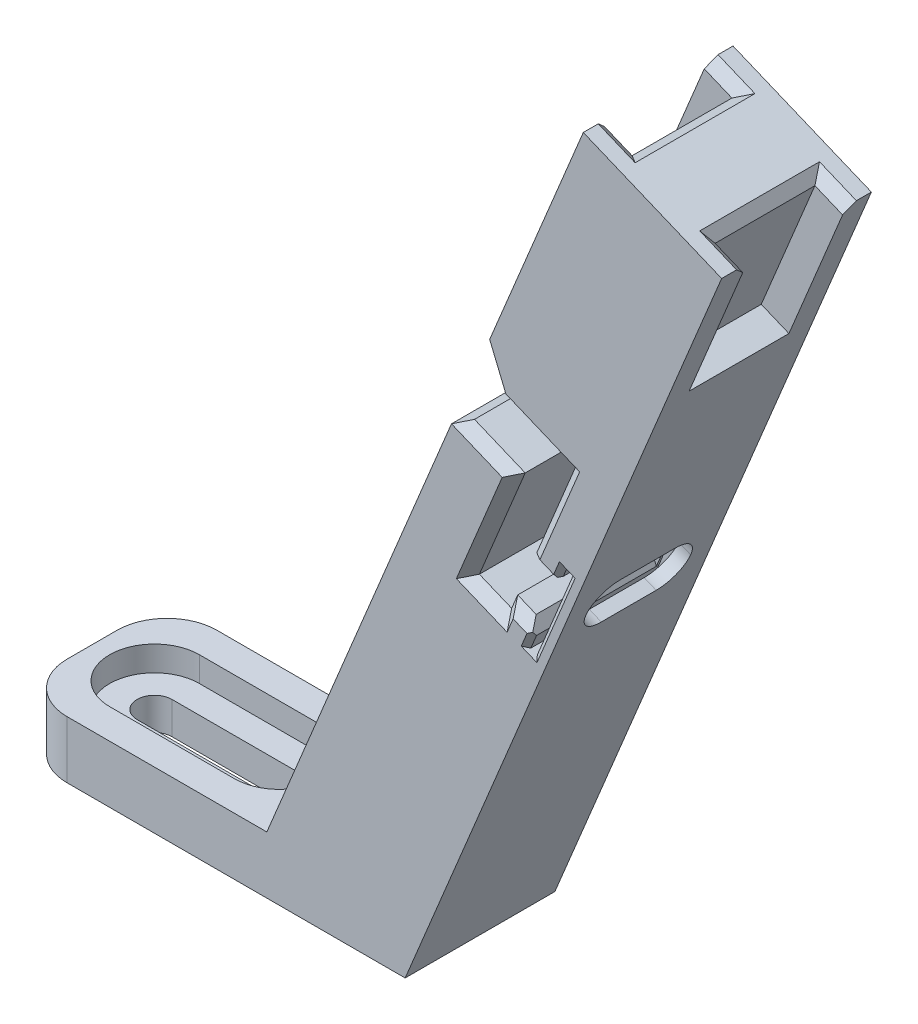
from build123d import *

# Parameters (mm, degrees)
BOSS_EXTRUDE1_DEPTH = 30
SKETCH4_W           = 30
SKETCH4_H           = 11.480502971
BOSS_EXTRUDE2_DEPTH = 50
CUT_EXTRUDE1_DEPTH  = 5
CUT_EXTRUDE3_DEPTH  = 6.480502971
FILLET1_R           = 10
CHAMFER3_SIZE       = 22.5
CHAMFER3_SIZE2      = 8.610377228
CHAMFER1_SIZE       = 15
CHAMFER1_SIZE2      = 20.645728807
CHAMFER2_SIZE2      = 20.645728807
CHAMFER2_SIZE       = 15
CUT_EXTRUDE4_DEPTH  = 25
CUT_EXTRUDE5_DEPTH  = 25
SKETCH9_W           = 20.645728807
SKETCH9_H           = 30
CUT_EXTRUDE6_DEPTH  = 40
SKETCH10_W          = 10
SKETCH10_H          = 12.413129657
BOSS_EXTRUDE3_DEPTH = 12
SKETCH11_W          = 31
SKETCH11_H          = 30
CUT_EXTRUDE7_DEPTH  = 2
SKETCH12_W          = 25.5
SKETCH12_H          = 20
CUT_EXTRUDE8_DEPTH  = 4
CHAMFER4_SIZE       = 2
CUT_EXTRUDE9_DEPTH  = 30
SKETCH16_W          = 6
SKETCH16_H          = 20
CUT_EXTRUDE10_DEPTH = 30.1
CHAMFER6_SIZE       = 2
BOSS_EXTRUDE4_DEPTH = 25.5
SKETCH18_W          = 2.6
SKETCH18_H          = 4.5
BOSS_EXTRUDE5_DEPTH = 10
CHAMFER7_SIZE       = 1
FILLET2_R           = 5
CHAMFER8_SIZE       = 8


with BuildPart() as part:
    # Sketch1 → Boss-Extrude1 (new body)
    with BuildSketch(Plane.XY):
        Polygon((0, 216.478440058), (-153.073372946, 153.073372946), (-216.478440058, 0), (-244.194826034, 0), (-244.194826034, 11.480502971), (-176.034378888, 176.034378888), (0, 248.950206067), align=None)
    extrude(amount=BOSS_EXTRUDE1_DEPTH)

    # Sketch4 → Boss-Extrude2 (add)
    with BuildSketch(Plane.ZY.offset(244.194826034)):
        with Locations((15, 5.740251485)):
            Rectangle(SKETCH4_W, SKETCH4_H)
    extrude(amount=BOSS_EXTRUDE2_DEPTH)

    # Sketch5 → Cut-Extrude1 (cut)
    with BuildSketch(Plane(origin=(0, 11.480502971, 0), x_dir=(1, 0, 0), z_dir=(0, 1, 0))):
        with BuildLine():
            Line((-281.694826034, -6), (-256.694826034, -6))
            ThreePointArc((-256.694826034, -6), (-247.694826034, -15), (-256.694826034, -24))
            Line((-256.694826034, -24), (-281.694826034, -24))
            ThreePointArc((-281.694826034, -24), (-290.694826034, -15), (-281.694826034, -6))
        make_face()
    extrude(amount=-CUT_EXTRUDE1_DEPTH, mode=Mode.SUBTRACT)

    # Sketch7 → Cut-Extrude3 (cut)
    with BuildSketch(Plane(origin=(0, 6.480502971, 0), x_dir=(1, 0, 0), z_dir=(0, 1, 0))):
        with BuildLine():
            Line((-256.694826034, -11.5), (-281.694826034, -11.5))
            ThreePointArc((-281.694826034, -11.5), (-285.194826034, -15), (-281.694826034, -18.5))
            Line((-281.694826034, -18.5), (-256.694826034, -18.5))
            ThreePointArc((-256.694826034, -18.5), (-253.194826034, -15), (-256.694826034, -11.5))
        make_face()
    extrude(amount=-CUT_EXTRUDE3_DEPTH, mode=Mode.SUBTRACT)

    # Fillet1
    fillet1_edges = [part.edges().sort_by_distance(p)[0] for p in [
        (-294.194826034, 5.740251485, 0),
        (-294.194826034, 5.740251485, 30),
    ]]
    fillet(fillet1_edges, radius=FILLET1_R)

    # Chamfer3
    chamfer3_edges = [part.edges().sort_by_distance(p)[0] for p in [
        (0, 248.950206067, 15),
    ]]
    chamfer3_side = [part.faces().sort_by_distance(p)[0] for p in [
        (-88.017189444, 212.492292478, 15),
    ]]
    chamfer(chamfer3_edges, length=CHAMFER3_SIZE, length2=CHAMFER3_SIZE2, reference=chamfer3_side[0])

    # Chamfer1
    chamfer1_edges = [part.edges().sort_by_distance(p)[0] for p in [
        (0, 228.409134449, 0),
    ]]
    chamfer1_side = [part.faces().sort_by_distance(p)[0] for p in [
        (0, 228.409134449, 15),
    ]]
    chamfer(chamfer1_edges, length=CHAMFER1_SIZE, length2=CHAMFER1_SIZE2, reference=chamfer1_side[0])

    # Chamfer2
    chamfer2_edges = [part.edges().sort_by_distance(p)[0] for p in [
        (0, 228.409134449, 30),
    ]]
    chamfer2_side = [part.faces().sort_by_distance(p)[0] for p in [
        (0, 228.409134449, 29.7),
    ]]
    chamfer(chamfer2_edges, length=CHAMFER2_SIZE - 0.0001, length2=CHAMFER2_SIZE2 - 0.0001, reference=chamfer2_side[0])  # a hair under: the kernel refuses the full size

    # Sketch3 → Cut-Extrude4 (cut)
    with BuildSketch(Plane.XY.offset(30)):
        Polygon((-186.689323664, 71.91728881), (-182.86248934, 81.156084136), (-192.101284666, 84.982918459), (-184.129988769, 104.227329121), (-202.60757942, 111.880997769), (-206.434413743, 102.642202444), (-194.423979821, 97.667317823), (-203.608382197, 75.494209043), (-197.14122547, 72.815425016), (-195.928118989, 75.744123134), align=None)
        Polygon((-81.156084136, 182.86248934), (-71.91728881, 186.689323664), (-75.744123134, 195.928118989), (-72.815425016, 197.14122547), (-75.494209043, 203.608382197), (-97.667317823, 194.423979821), (-102.642202444, 206.434413743), (-111.880997769, 202.60757942), (-106.906113148, 190.597145497), (-104.227329121, 184.129988769), (-84.982918459, 192.101284666), align=None)
    extrude(amount=-CUT_EXTRUDE4_DEPTH, mode=Mode.SUBTRACT)

    # Sketch8 → Cut-Extrude5 (cut)
    with BuildSketch(Plane.XY.offset(30)):
        Polygon((-66.282610192, 194.435244969), (-67.813343921, 198.130763099), (-66.889464389, 198.513446531), (-70.716298712, 207.752241857), (-71.640178245, 207.369558424), (-73.170911974, 211.065076554), (-72.247032442, 211.447759987), (-74.925816468, 217.914916714), (-46.28555096, 229.778103118), (-43.606766934, 223.31094639), (-38.987369271, 225.224363552), (-37.456635542, 221.528845422), (-42.076033204, 219.61542826), (-38.249198881, 210.376632935), (-33.629801218, 212.290050097), (-32.099067489, 208.594531967), align=None)
    extrude(amount=-CUT_EXTRUDE5_DEPTH, mode=Mode.SUBTRACT)

    # Sketch9 → Cut-Extrude6 (cut)
    with BuildSketch(Plane(origin=(0, 240.339828839, 0), x_dir=(1, 0, 0), z_dir=(0, 1, 0))):
        with Locations((-10.322864404, -15)):
            Rectangle(SKETCH9_W, SKETCH9_H)
    extrude(amount=-CUT_EXTRUDE6_DEPTH, mode=Mode.SUBTRACT)


with BuildPart() as cut_extrude6_kept_piece:
    # of the separate pieces the step leaves, the one the design keeps (cut_extrude6_pieces_kept)
    add(part.part.solids().sort_by_distance((-20.787289482, 240.339828839, 30))[0])

    # Sketch10 → Boss-Extrude3 (add)
    with BuildSketch(Plane(origin=(-20.645728807, 0, 0), x_dir=(0, 0, -1), z_dir=(1, 0, 0))):
        with Locations((-15, 224.13326401)):
            Rectangle(SKETCH10_W, SKETCH10_H)
    extrude(amount=BOSS_EXTRUDE3_DEPTH)

    # Sketch11 → Cut-Extrude7 (cut)
    with BuildSketch(Plane(origin=(-76.536686473, 184.775906502, 0), x_dir=(0.9238795325112865, 0.38268343236509045, 0), z_dir=(0.38268343236509045, -0.9238795325112865, 0))):
        with Locations((0.5, 15)):
            Rectangle(SKETCH11_W, SKETCH11_H)
    extrude(amount=-CUT_EXTRUDE7_DEPTH, mode=Mode.SUBTRACT)

    # Sketch12 → Cut-Extrude8 (cut)
    with BuildSketch(Plane(origin=(-184.775906502, 76.536686473, 0), x_dir=(0, 0, -1), z_dir=(0.9238795325112872, -0.38268343236508917, 0))):
        with Locations((-17.25, 0)):
            Rectangle(SKETCH12_W, SKETCH12_H)
    extrude(amount=-CUT_EXTRUDE8_DEPTH, mode=Mode.SUBTRACT)

    # Chamfer4
    chamfer4_edges = [cut_extrude6_kept_piece.edges().sort_by_distance(p)[0] for p in [
        (-111.880997769, 202.60757942, 17.5),
        (-102.642202444, 206.434413743, 17.5),
        (-83.45218473, 188.405766535, 30),
        (-74.279774075, 196.534672229, 30),
        (-74.154817029, 200.374803834, 30),
        (-86.580763433, 199.016181009, 30),
        (-100.154760133, 200.429196782, 30),
        (-108.054163445, 193.368784094, 30),
        (-94.60512379, 188.115636717, 30),
        (-206.434413743, 102.642202444, 17.5),
        (-188.115636717, 94.60512379, 30),
        (-193.368784094, 108.054163445, 30),
        (-200.429196782, 100.154760133, 30),
        (-199.016181009, 86.580763433, 30),
        (-200.374803834, 74.154817029, 30),
        (-196.534672229, 74.279774075, 30),
        (-193.156480392, 74.596072837, 30),
        (-49.19083884, 201.514888468, 30),
        (-32.864434353, 210.442291032, 30),
        (-40.162616043, 214.996030597, 30),
        (-38.222002407, 223.376604487, 30),
        (-72.40554511, 209.217317489, 30),
        (-67.047977056, 196.283004034, 30),
        (-74.213389405, 192.232600859, 30),
        (-81.921451, 184.710248405, 17.5),
        (-72.682655675, 188.537082729, 17.5),
        (-189.329646068, 83.834868162, 30),
        (-186.55800747, 82.686817865, 17.5),
        (-190.384841794, 73.44802254, 17.5),
    ]]
    chamfer(chamfer4_edges, length=CHAMFER4_SIZE)

    # Sketch13 → Cut-Extrude9 (cut)
    with BuildSketch(Plane(origin=(0, 0, 0), x_dir=(-1, 0, 0), z_dir=(0, 0, -1))):
        Polygon((180.789758921, 164.553875917), (153.073372946, 153.073372946), (-25.433862624, 226.424491684), (-10.416597064, 262.970499532), (187.527299345, 181.632585119), align=None)
    extrude(amount=-CUT_EXTRUDE9_DEPTH, mode=Mode.SUBTRACT)

    # Sketch16 → Cut-Extrude10 (cut)
    with BuildSketch(Plane(origin=(31.702533556, 76.536686473, 0), x_dir=(0.9238795325112868, -0.38268343236508956, 0), z_dir=(0.38268343236508956, 0.9238795325112868, 0))):
        with Locations((-227, -15)):
            Rectangle(SKETCH16_W, SKETCH16_H)
        with Locations((-203, -15)):
            Rectangle(SKETCH16_W, SKETCH16_H)
    extrude(amount=-CUT_EXTRUDE10_DEPTH, mode=Mode.SUBTRACT)

    # Chamfer6
    chamfer6_edges = [cut_extrude6_kept_piece.edges().sort_by_distance(p)[0] for p in [
        (-178.018120324, 163.40582562, 25),
        (-175.246481726, 162.257775323, 15),
        (-178.018120324, 163.40582562, 5),
        (-155.845011544, 154.221423243, 5),
        (-158.616650141, 155.36947354, 15),
        (-155.845011544, 154.221423243, 25),
    ]]
    chamfer(chamfer6_edges, length=CHAMFER6_SIZE)

    # Sketch17 → Boss-Extrude4 (add)
    with BuildSketch(Plane.XY.offset(4.5)):
        Polygon((-188.602740826, 67.297891148), (-191.00482761, 68.292868072), (-189.091410449, 72.912265735), (-186.689323664, 71.91728881), align=None)
        Polygon((-183.351158963, 86.770458722), (-180.949072179, 85.775481798), (-182.86248934, 81.156084136), (-185.264576125, 82.15106106), align=None)
    extrude(amount=BOSS_EXTRUDE4_DEPTH)

    # Sketch18 → Boss-Extrude5 (add)
    with BuildSketch(Plane(origin=(-1.913417162, -4.619397663, 0), x_dir=(0.9238795325112867, -0.38268343236508984, 0), z_dir=(0.38268343236508984, 0.9238795325112867, 0))):
        with Locations((-201.3, -27.75)):
            Rectangle(SKETCH18_W, SKETCH18_H)
    extrude(amount=BOSS_EXTRUDE5_DEPTH)

    # Chamfer7
    chamfer7_edges = [cut_extrude6_kept_piece.edges().sort_by_distance(p)[0] for p in [
        (-185.218615457, 85.920396229, 30),
        (-191.724233807, 70.214444176, 30),
        (-187.177993287, 77.531663397, 30),
    ]]
    chamfer(chamfer7_edges, length=CHAMFER7_SIZE)

    # Fillet2
    fillet2_edges = [cut_extrude6_kept_piece.edges().sort_by_distance(p)[0] for p in [
        (-187.890367056, 72.414777273, 25.5),
        (-184.063532733, 81.653572598, 25.5),
        (-184.063532733, 81.653572598, 4.5),
        (-187.890367056, 72.414777273, 4.5),
    ]]
    fillet(fillet2_edges, radius=FILLET2_R - 0.0001)  # a hair under: the kernel refuses the full size

    # Chamfer8
    chamfer8_edges = [cut_extrude6_kept_piece.edges().sort_by_distance(p)[0] for p in [
        (-202.60757942, 111.880997769, 16.5),
    ]]
    chamfer(chamfer8_edges, length=CHAMFER8_SIZE)


solid = cut_extrude6_kept_piece.part
